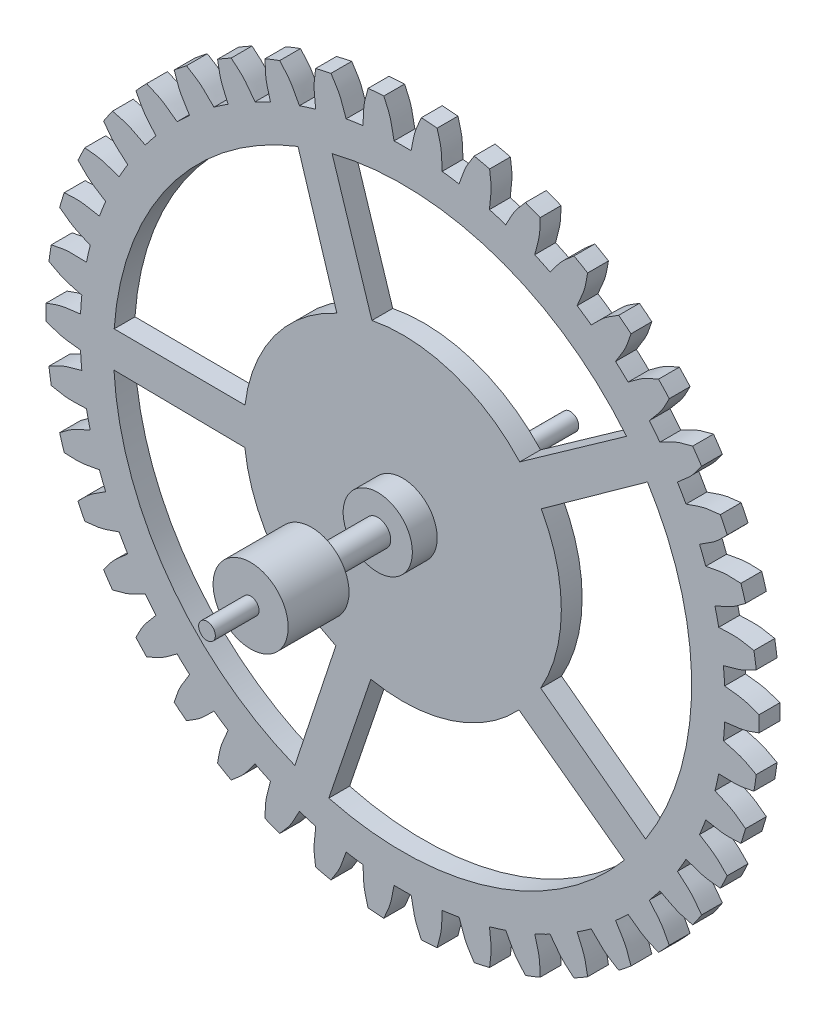
from build123d import *

# Parameters (mm, degrees)
SCALE1_START         = 5.770552844
SCALE1_OUTLINE_R     = 4.178387848
SCALE1_DEPTH         = 0.244
SCALE1_START_2       = 7.081951853
SCALE1_2_OUTLINE_R   = 0.439810574
SCALE1_2_DEPTH       = 0.713039421
SCALE1_START_3       = 5.435421028
SCALE1_3_OUTLINE_R   = 0.28759809
SCALE1_3_DEPTH       = 0.870108097
SCALE1_START_4       = 6.014552844
SCALE1_4_OUTLINE_R   = 0.405526066
SCALE1_4_OUTLINE_R_2 = 0.28759809
SCALE1_4_DEPTH       = 0.290976281
SCALE1_START_5       = 5.250155145
SCALE1_5_OUTLINE_R   = 0.144551377
SCALE1_5_DEPTH       = 1.831796708
SCALE1_START_6       = 7.794991274
SCALE1_6_OUTLINE_R   = 0.097928823
SCALE1_6_DEPTH       = 0.21165972
SCALE1_START_7       = 6.305529125
SCALE1_7_OUTLINE_R   = 0.151808135
SCALE1_7_OUTLINE_R_2 = 0.144551377
SCALE1_7_DEPTH       = 0.776422728
CUT_EXTRUDE1_DEPTH   = 33.745910672
CIRPATTERN1_COUNT    = 42
SKETCH2_R            = 0.097928823
BOSS_EXTRUDE1_DEPTH  = 0.3
SKETCH3_R            = 0.1
BOSS_EXTRUDE2_DEPTH  = 1.2


with BuildPart() as part:
    # Scale1: read off the stored shape, not the designer's step
    # Scale1 outline → Scale1 (new body)
    with BuildSketch(Plane.XY.offset(SCALE1_START)):
        with Locations((-9.535657883, -25.473247528)):
            Circle(SCALE1_OUTLINE_R)
        with BuildLine():
            ThreePointArc((-10.798570637, -28.616605932), (-12.287997597, -27.448159368), (-12.917913395, -25.662979788))
            Line((-12.917913395, -25.662979788), (-11.384175407, -25.682398139))
            ThreePointArc((-11.384175407, -25.682398139), (-11.044542195, -26.561378563), (-10.31776152, -27.161167822))
            Line((-10.31776152, -27.161167822), (-10.798570637, -28.616605932))
        make_face(mode=Mode.SUBTRACT)
        with BuildLine():
            ThreePointArc((-6.936407893, -27.645700098), (-8.507924854, -28.70115947), (-10.400386213, -28.748594165))
            Line((-10.400386213, -28.748594165), (-9.907967161, -27.295923259))
            ThreePointArc((-9.907967161, -27.295923259), (-8.967054667, -27.244532768), (-8.172033604, -26.738668345))
            Line((-8.172033604, -26.738668345), (-6.936407893, -27.645700098))
        make_face(mode=Mode.SUBTRACT)
        with BuildLine():
            ThreePointArc((-6.66632029, -23.672538651), (-6.148144225, -25.493294981), (-6.68783387, -27.307790815))
            Line((-6.68783387, -27.307790815), (-7.917240146, -26.390572469))
            ThreePointArc((-7.917240146, -26.390572469), (-7.675357457, -25.479830975), (-7.910788093, -24.567400309))
            Line((-7.910788093, -24.567400309), (-6.66632029, -23.672538651))
        make_face(mode=Mode.SUBTRACT)
        with BuildLine():
            ThreePointArc((-12.915430879, -25.24349729), (-12.264430403, -23.465898228), (-10.761278417, -22.315161876))
            Line((-10.761278417, -22.315161876), (-10.305795264, -23.779833984))
            ThreePointArc((-10.305795264, -23.779833984), (-11.036802889, -24.374464252), (-11.382648792, -25.251018823))
            Line((-11.382648792, -25.251018823), (-12.915430879, -25.24349729))
        make_face(mode=Mode.SUBTRACT)
        with BuildLine():
            Line((-9.895057404, -23.647982342), (-10.361559715, -22.187895668))
            ThreePointArc((-10.361559715, -22.187895668), (-8.469792333, -22.257725594), (-6.910877518, -23.331710996))
            Line((-6.910877518, -23.331710996), (-8.163111435, -24.21750979))
            ThreePointArc((-8.163111435, -24.21750979), (-8.954532206, -23.706031083), (-9.895057404, -23.647982342))
        make_face(mode=Mode.SUBTRACT)
    extrude(amount=SCALE1_DEPTH)

    # Scale1 3 outline → Scale1 3 (add)
    with BuildSketch(Plane.XY.offset(SCALE1_START_3)):
        with Locations((-9.535657883, -25.473247528)):
            Circle(SCALE1_3_OUTLINE_R)
    extrude(amount=SCALE1_3_DEPTH)

    # Scale1 4 outline → Scale1 4 (add)
    with BuildSketch(Plane.XY.offset(SCALE1_START_4)):
        with Locations((-9.535657883, -25.473247528)):
            Circle(SCALE1_4_OUTLINE_R)
        with Locations((-9.535657883, -25.473247528)):
            Circle(SCALE1_4_OUTLINE_R_2, mode=Mode.SUBTRACT)
    extrude(amount=SCALE1_4_DEPTH)



with BuildPart() as body_2:
    # Scale1 2 outline → Scale1 2 (new body)
    with BuildSketch(Plane.XY.offset(SCALE1_START_2)):
        with Locations((-9.535657883, -25.473247528)):
            Circle(SCALE1_2_OUTLINE_R)
    extrude(amount=SCALE1_2_DEPTH)


with BuildPart() as part_1:
    add(part.part)

    add(body_2.part)  # Scale1 5 merges body 2
    # Scale1 5 outline → Scale1 5 (add)
    with BuildSketch(Plane.XY.offset(SCALE1_START_5)):
        with Locations((-9.535657883, -25.473247528)):
            Circle(SCALE1_5_OUTLINE_R)
    extrude(amount=SCALE1_5_DEPTH)

    # Scale1 6 outline → Scale1 6 (add)
    with BuildSketch(Plane.XY.offset(SCALE1_START_6)):
        with Locations((-9.535657883, -25.473247528)):
            Circle(SCALE1_6_OUTLINE_R)
    extrude(amount=SCALE1_6_DEPTH)

    # Scale1 7 outline → Scale1 7 (add)
    with BuildSketch(Plane.XY.offset(SCALE1_START_7)):
        with Locations((-9.535657883, -25.473247528)):
            Circle(SCALE1_7_OUTLINE_R)
        with Locations((-9.535657883, -25.473247528)):
            Circle(SCALE1_7_OUTLINE_R_2, mode=Mode.SUBTRACT)
    extrude(amount=SCALE1_7_DEPTH)

    # Sketch1 → Cut-Extrude1 (cut, through all)
    with BuildSketch(Plane(origin=(0, 0, 5.770552844), x_dir=(-1, 0, 0), z_dir=(0, 0, -1))):
        with BuildLine():
            Line((9.315657883, -29.645839649), (9.315657883, -29.837945319))
            Line((9.315657883, -29.837945319), (9.755657883, -29.837945319))
            Line((9.755657883, -29.837945319), (9.755657883, -29.645839649))
            add(Edge.make_bspline(
                [(9.635657883, -29.250311829), (9.672506891, -29.436964318), (9.668819648, -29.461615735), (9.755657883, -29.645839649)],
                knots=[0, 0, 0, 0, 1, 1, 1, 1], degree=3))
            ThreePointArc((9.635657883, -29.250311829), (9.535657883, -29.251635376), (9.435657883, -29.250311829))
            add(Edge.make_bspline(
                [(9.435657883, -29.250311829), (9.398808875, -29.436964318), (9.402496117, -29.461615735), (9.315657883, -29.645839649)],
                knots=[0, 0, 0, 0, 1, 1, 1, 1], degree=3))
        make_face()
    cut_extrude1 = extrude(amount=-CUT_EXTRUDE1_DEPTH, mode=Mode.SUBTRACT)

    # CirPattern1: Cut-Extrude1 ×42 about axis
    cirpattern1_axis = Axis((-9.535657883, -25.473247528, 6.693740489), (0, 0, 1))
    for i in range(1, CIRPATTERN1_COUNT):
        add(cut_extrude1.rotate(cirpattern1_axis, i * 360 / CIRPATTERN1_COUNT), mode=Mode.SUBTRACT)

    # Sketch2 → Boss-Extrude1 (add)
    with BuildSketch(Plane.XY.offset(8.006650994)):
        with Locations((-9.535657883, -25.473247528)):
            Circle(SKETCH2_R)
    extrude(amount=BOSS_EXTRUDE1_DEPTH)

    # Sketch3 → Boss-Extrude2 (add)
    with BuildSketch(Plane(origin=(0, 0, 5.250155145), x_dir=(-1, 0, 0), z_dir=(0, 0, -1))):
        with Locations((9.535657883, -25.473247528)):
            Circle(SKETCH3_R)
    extrude(amount=BOSS_EXTRUDE2_DEPTH)


solid = part_1.part
